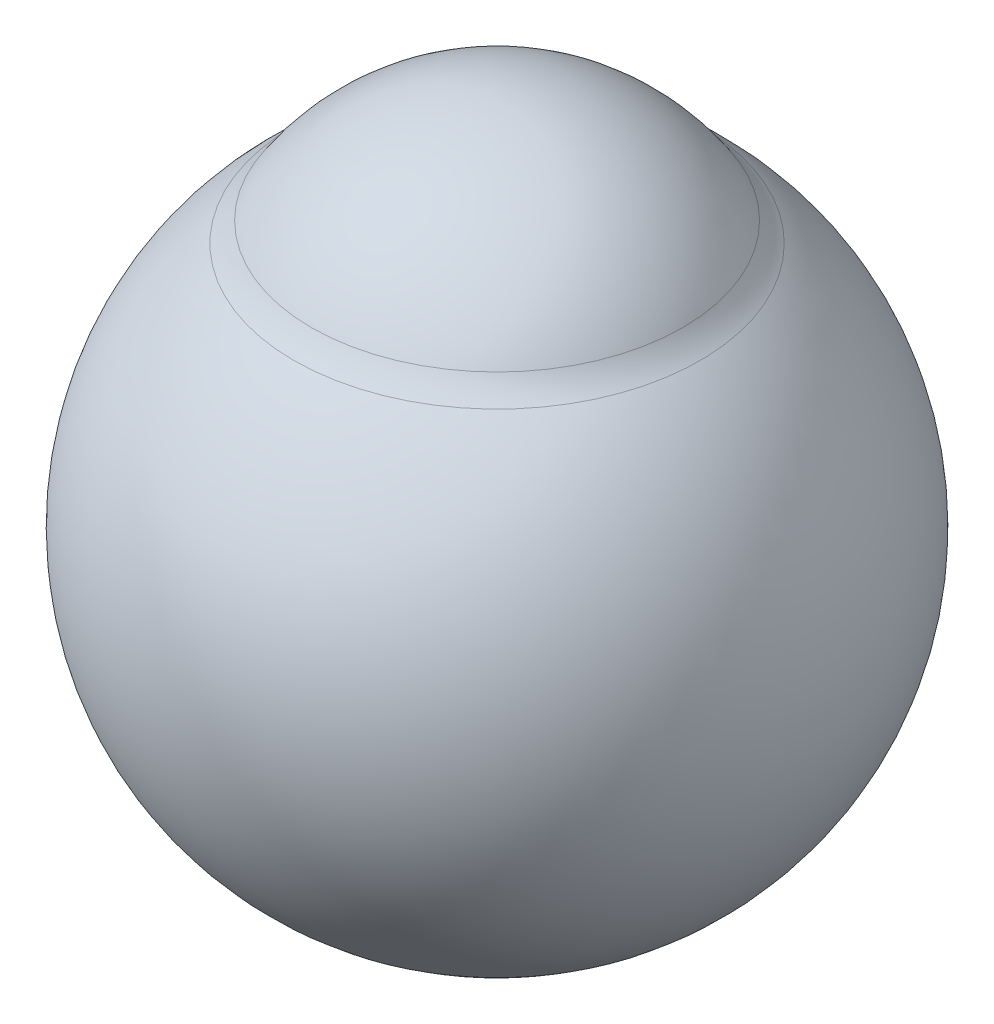
from build123d import *


with BuildPart() as part:
    # Sketch6 → Revolve2 (revolve)
    with BuildSketch(Plane.XY):
        with BuildLine():
            ThreePointArc((4.704997748, 2.904001144), (2.424869951, 3.781546563), (0, 4.08))
            Line((0, 4.08), (0, 0.38))
            ThreePointArc((0, 0.38), (2.643822882, 0.993888177), (4.746641894, 2.709933144))
            ThreePointArc((4.746641894, 2.709933144), (4.77088424, 2.816637307), (4.704997748, 2.904001144))
        make_face()
    revolve(axis=Axis((0, 60.244207804, 0), (0, -1, 0)))


with BuildPart() as body_2:
    # Sketch6<7> → Revolve5 (revolve)
    with BuildSketch(Plane.XY):
        with BuildLine():
            Line((5.886123402, 4.08), (5.548153632, 4.336060606))
            ThreePointArc((5.548153632, 4.336060606), (5.553680131, 4.233128157), (5.465345369, 4.18))
            Line((5.465345369, 4.18), (1.5, 4.18))
            Line((1.5, 4.18), (1.5, 4.08))
            Line((1.5, 4.08), (5.492861113, 4.08))
            Line((5.492861113, 4.08), (5.886123402, 4.08))
        make_face()
    revolve(axis=Axis((0, 60.244207804, 0), (0, -1, 0)))

    # Sketch6<8> → Revolve6 (revolve)
    with BuildSketch(Plane.XY):
        with BuildLine():
            Line((6.45968041, 3.692562089), (5.886123402, 4.08))
            Line((5.886123402, 4.08), (5.492861113, 4.08))
            ThreePointArc((5.492861113, 4.08), (5.666844203, 3.978640177), (5.66447834, 3.777298844))
            add(Edge.make_bspline(
                [(5.66447834, 3.777298844), (5.52797511, 3.549197167), (5.417228742, 2.854359981), (6.983816782, 2.521940583), (8.08067984, 1.917370456), (8.532298411, 1.729952463)],
                knots=[0.065550843, 0.065550843, 0.065550843, 0.065550843, 0.226972151, 0.688222094, 1, 1, 1, 1], degree=3))
            ThreePointArc((8.532298411, 1.729952463), (7.559948173, 2.778801061), (6.45968041, 3.692562089))
        make_face()
    revolve(axis=Axis((0, 60.244207804, 0), (0, -1, 0)))

    # Sketch6<9> → Revolve7 (revolve)
    with BuildSketch(Plane.XY):
        with BuildLine():
            add(Edge.make_bspline(
                [(5.548153632, 4.336060606), (5.40298249, 5.044933477), (6.051343216, 4.92625791), (6.520858839, 4.28)],
                knots=[0, 0, 0, 0, 1, 1, 1, 1], degree=3))
            Line((5.548153632, 4.336060606), (5.886123402, 4.08))
            Line((5.886123402, 4.08), (6.45968041, 3.692562089))
            ThreePointArc((6.45968041, 3.692562089), (7.559948173, 2.778801061), (8.532298411, 1.729952463))
            ThreePointArc((8.532298411, 1.729952463), (9.928284236, -9.929455102), (0, -16.2))
            Line((0, -16.2), (0, -16.52))
            ThreePointArc((0, -16.52), (10.633298815, -9.043997424), (7.196762351, 3.491866142))
            ThreePointArc((7.196762351, 3.491866142), (6.859713943, 3.817824959), (6.577571883, 4.192320136))
            ThreePointArc((6.577571883, 4.192320136), (6.54936209, 4.236254975), (6.520858839, 4.28))
        make_face()
    revolve(axis=Axis((0, 60.244207804, 0), (0, -1, 0)))

    # Sketch6<10> → Revolve8 (revolve)
    with BuildSketch(Plane.XY):
        with BuildLine():
            ThreePointArc((0, 7.28), (3.140413503, 6.498429102), (5.548153632, 4.336060606))
            add(Edge.make_bspline(
                [(5.548153632, 4.336060606), (5.40298249, 5.044933477), (6.051343216, 4.92625791), (6.520858839, 4.28)],
                knots=[0, 0, 0, 0, 1, 1, 1, 1], degree=3))
            ThreePointArc((6.520858839, 4.28), (3.705131577, 6.863818179), (0, 7.8))
            Line((0, 7.8), (0, 7.28))
        make_face()
    revolve(axis=Axis((0, 60.244207804, 0), (0, -1, 0)))


solid = Compound([part.part, body_2.part])
